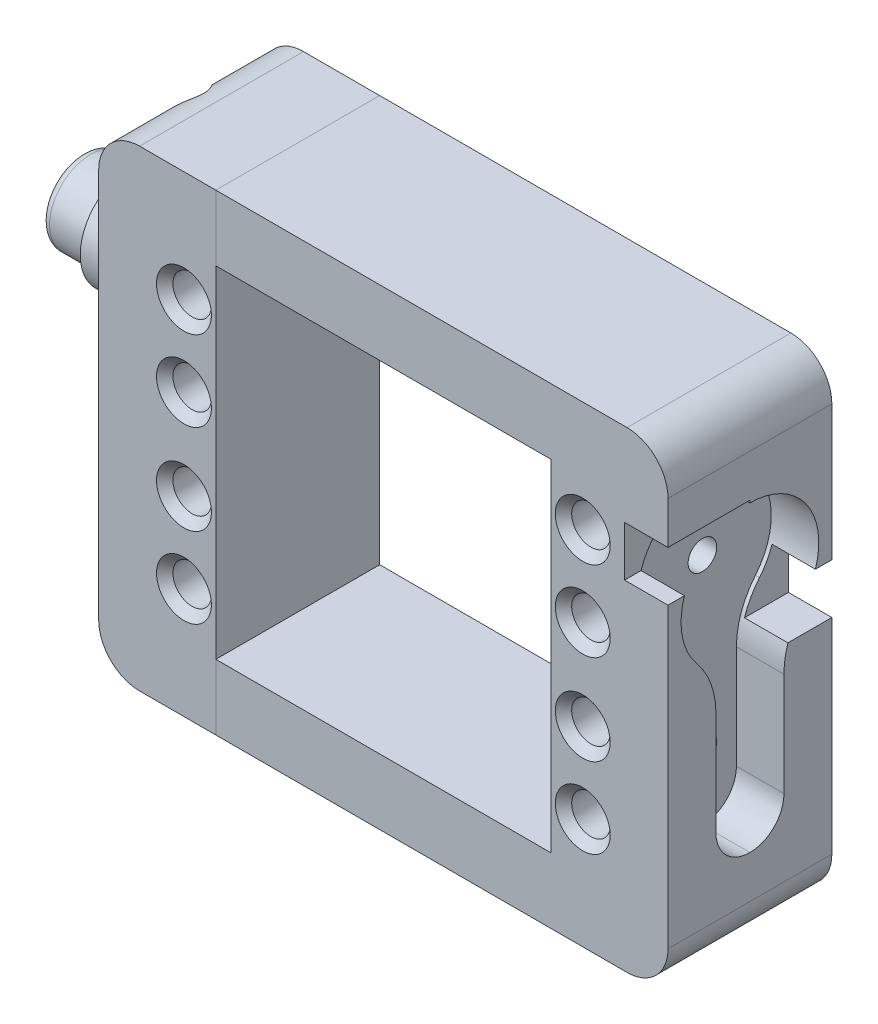
from build123d import *

# Parameters (mm, degrees)
SKETCH1_W              = 20
SKETCH1_H              = 20
BOSS_EXTRUDE1_DEPTH    = 20
SKETCH2_W              = 20
SKETCH2_H              = 70
BOSS_EXTRUDE2_DEPTH    = 10.3
CUT_EXTRUDE1_DEPTH     = 5.8
FILLET1_R              = 4.15
FILLET2_R              = 10
SKETCH5_R              = 1.75
CUT_EXTRUDE2_DEPTH     = 48.361271098
CUT_EXTRUDE3_REACH     = 45.878
SKETCH6_R              = 1.75
SKETCH13_W             = 20
SKETCH13_H             = 20
CUT_EXTRUDE9_DEPTH     = 20
CUT_EXTRUDE18_DEPTH    = 5.3
SKETCH32_W             = 20
SKETCH32_H             = 3.725
BOSS_EXTRUDE3_DEPTH    = 10.3
SKETCH31_W             = 20
SKETCH31_H             = 16.125
CUT_EXTRUDE19_DEPTH    = 42.300310229
SKETCH34_W             = 20
SKETCH34_H             = 57.6
SKETCH34_R             = 1.75
BOSS_EXTRUDE5_DEPTH    = 4
SKETCH35_W             = 20
SKETCH35_H             = 8
BOSS_EXTRUDE6_DEPTH    = 40.9
SKETCH37_W             = 20
SKETCH37_H             = 57.6
BOSS_EXTRUDE7_DEPTH    = 14.3
SKETCH38_R             = 2.35
CUT_EXTRUDE20_DEPTH    = 8
CHAMFER1_SIZE          = 1
SKETCH41_R             = 3.5
CUT_EXTRUDE23_DEPTH    = 4
SKETCH42_R             = 1.75
CUT_EXTRUDE24_DEPTH    = 22.3
SKETCH43_R             = 3.5
CUT_EXTRUDE25_DEPTH    = 11
FILLET3_R              = 5
SPLIT1_SURFACE_1_BACK  = 93.455
SPLIT1_SURFACE_1_DEPTH = 186.91
SPLIT1_SURFACE_2_BACK  = 93.455
SPLIT1_SURFACE_2_DEPTH = 186.91
SKETCH45_R             = 2.35
CUT_EXTRUDE26_DEPTH    = 8
CHAMFER2_SIZE          = 1
SKETCH46_R             = 5
BOSS_EXTRUDE8_DEPTH    = 12
FILLET5_R              = 1
SKETCH50_R             = 6.25
BOSS_EXTRUDE9_DEPTH    = 6
FILLET6_R              = 3


# Some blends are built 0.0001 mm under size
with BuildPart() as part:
    # Sketch1 → Boss-Extrude1 (new body)
    with BuildSketch(Plane(origin=(0, 0, 0), x_dir=(0, 0, -1), z_dir=(1, 0, 0))):
        Rectangle(SKETCH1_W, SKETCH1_H)
    extrude(amount=BOSS_EXTRUDE1_DEPTH)

    # Sketch2 → Boss-Extrude2 (add)
    with BuildSketch(Plane(origin=(20, 0, 0), x_dir=(0, 0, -1), z_dir=(1, 0, 0))):
        Rectangle(SKETCH2_W, SKETCH2_H)
    extrude(amount=BOSS_EXTRUDE2_DEPTH)

    # Sketch4 → Cut-Extrude1 (cut)
    with BuildSketch(Plane(origin=(30.3, 0, 0), x_dir=(0, 0, -1), z_dir=(1, 0, 0))):
        with BuildLine():
            Line((4.15, -28.55), (-4.15, -28.55))
            Line((-4.15, -28.55), (-4.15, -7.311805523))
            ThreePointArc((-4.15, -7.311805523), (0, 8.407437184), (4.15, -7.311805523))
            Line((4.15, -7.311805523), (4.15, -28.55))
        make_face()
    extrude(amount=-CUT_EXTRUDE1_DEPTH, mode=Mode.SUBTRACT)

    # Fillet1
    fillet1_edges = [part.edges().sort_by_distance(p)[0] for p in [
        (27.4, -28.55, 4.15),
        (27.4, -28.55, -4.15),
    ]]
    fillet(fillet1_edges, radius=FILLET1_R - 0.0001)  # a hair under: the kernel refuses the full size

    # Fillet2
    fillet2_edges = [part.edges().sort_by_distance(p)[0] for p in [
        (27.4, -7.311805523, 4.15),
        (27.4, -7.311805523, -4.15),
    ]]
    fillet(fillet2_edges, radius=FILLET2_R)

    # Sketch5 → Cut-Extrude2 (cut, through all)
    with BuildSketch(Plane.ZY):
        Circle(SKETCH5_R)
    extrude(amount=-CUT_EXTRUDE2_DEPTH, mode=Mode.SUBTRACT)

    # Sketch6 → Cut-Extrude3 (cut, up to next)
    with BuildSketch(Plane(origin=(24.5, 0, 0), x_dir=(0, 0, -1), z_dir=(1, 0, 0)), mode=Mode.PRIVATE) as cut_extrude3_sk1:
        with Locations((0, -20.6)):
            Circle(SKETCH6_R)
    cut_extrude3_tool1 = extrude(cut_extrude3_sk1.sketch, amount=-CUT_EXTRUDE3_REACH, mode=Mode.PRIVATE) & part.part
    add(cut_extrude3_tool1.solids().sort_by_distance((24.5, -20.6, 0))[0], mode=Mode.SUBTRACT)

    # Sketch13 → Cut-Extrude9 (cut)
    with BuildSketch(Plane.ZY):
        Rectangle(SKETCH13_W, SKETCH13_H)
    extrude(amount=-CUT_EXTRUDE9_DEPTH, mode=Mode.SUBTRACT)

    # Sketch29 → Cut-Extrude18 (cut)
    with BuildSketch(Plane(origin=(30.3, 0, 0), x_dir=(0, 0, -1), z_dir=(1, 0, 0))):
        Polygon((15.109449768, -8.7), (15.109449768, -2.6), (0, -2.6), (0, -3.8), (0, -7.5), (0, -8.7), align=None)
        Polygon((0, 2.6), (-15.109449768, 2.6), (-15.109449768, 8.7), (0, 8.7), (0, 7.5), (0, 3.8), align=None)
    extrude(amount=-CUT_EXTRUDE18_DEPTH, mode=Mode.SUBTRACT)

    # Sketch32 → Boss-Extrude3 (add)
    with BuildSketch(Plane(origin=(30.3, 0, 0), x_dir=(0, 0, -1), z_dir=(1, 0, 0))):
        with Locations((0, -36.8625)):
            Rectangle(SKETCH32_W, SKETCH32_H)
    extrude(amount=-BOSS_EXTRUDE3_DEPTH)

    # Sketch31 → Cut-Extrude19 (cut, through all)
    with BuildSketch(Plane(origin=(30.3, 0, 0), x_dir=(0, 0, -1), z_dir=(1, 0, 0))):
        with Locations((0, 26.9375)):
            Rectangle(SKETCH31_W, SKETCH31_H)
    extrude(amount=-CUT_EXTRUDE19_DEPTH, mode=Mode.SUBTRACT)

    # Sketch34 → Boss-Extrude5 (add)
    with BuildSketch(Plane.ZY.offset(-20)):
        with Locations((0, -9.925)):
            Rectangle(SKETCH34_W, SKETCH34_H)
        with Locations(Location((0, -20.6, 0), (0, 0, 180))):
            Circle(SKETCH34_R, mode=Mode.SUBTRACT)
        Circle(SKETCH34_R, mode=Mode.SUBTRACT)
    extrude(amount=BOSS_EXTRUDE5_DEPTH)

    # Sketch35 → Boss-Extrude6 (add)
    with BuildSketch(Plane.ZY.offset(-16)):
        with Locations((0, 14.875)):
            Rectangle(SKETCH35_W, SKETCH35_H)
        with Locations((0, -34.725)):
            Rectangle(SKETCH35_W, SKETCH35_H)
    extrude(amount=BOSS_EXTRUDE6_DEPTH)

    # Sketch37 → Boss-Extrude7 (add)
    with BuildSketch(Plane.ZY.offset(24.9)):
        with Locations((0, -9.925)):
            Rectangle(SKETCH37_W, SKETCH37_H)
    extrude(amount=BOSS_EXTRUDE7_DEPTH)

    # Sketch38 → Cut-Extrude20 (cut)
    with BuildSketch(Plane.XY.offset(10)):
        with Locations((-28.79, 5.375)):
            Circle(SKETCH38_R)
        with Locations(Location((-28.79, -4.425, 0), (0, 0, 180))):
            Circle(SKETCH38_R)
        with Locations(Location((-28.79, -25.225, 0), (0, 0, 180))):
            Circle(SKETCH38_R)
        with Locations((-28.79, -15.425)):
            Circle(SKETCH38_R)
        with Locations(Location((19.89, 5.375, 0), (0, 0, 180))):
            Circle(SKETCH38_R)
        with Locations((19.89, -4.425)):
            Circle(SKETCH38_R)
        with Locations(Location((19.89, -15.425, 0), (0, 0, 180))):
            Circle(SKETCH38_R)
        with Locations((19.89, -25.225)):
            Circle(SKETCH38_R)
    extrude(amount=-CUT_EXTRUDE20_DEPTH, mode=Mode.SUBTRACT)

    # Chamfer1
    chamfer1_edges = [part.edges().sort_by_distance(p)[0] for p in [
        (22.24, 5.375, 10),
        (-31.14, -15.425, 10),
        (-26.44, -25.225, 10),
        (-26.44, -4.425, 10),
        (17.54, -4.425, 10),
        (22.24, -15.425, 10),
        (17.54, -25.225, 10),
        (-31.14, 5.375, 10),
    ]]
    chamfer(chamfer1_edges, length=CHAMFER1_SIZE)

    # Sketch41 → Cut-Extrude23 (cut)
    with BuildSketch(Plane.ZY.offset(-16)):
        Circle(SKETCH41_R)
        with Locations((0, -20.6)):
            Circle(SKETCH41_R)
    extrude(amount=-CUT_EXTRUDE23_DEPTH, mode=Mode.SUBTRACT)

    # Sketch42 → Cut-Extrude24 (cut)
    with BuildSketch(Plane.ZY.offset(39.2)):
        with Locations((0, -34.725)):
            Circle(SKETCH42_R)
        with Locations(Location((0, 14.875, 0), (0, 0, 180))):
            Circle(SKETCH42_R)
    extrude(amount=-CUT_EXTRUDE24_DEPTH, mode=Mode.SUBTRACT)

    # Sketch43 → Cut-Extrude25 (cut)
    with BuildSketch(Plane.ZY.offset(39.2)):
        with Locations((0, 14.875)):
            Circle(SKETCH43_R)
        with Locations((0, -34.725)):
            Circle(SKETCH43_R)
    extrude(amount=-CUT_EXTRUDE25_DEPTH, mode=Mode.SUBTRACT)

    # Fillet3
    # the kernel refuses this fillet: 5 mm, written as the material it takes off along each edge
    with BuildSketch(Plane(origin=(30.3, -38.725, -22.5), x_dir=(-1, 0, 0), z_dir=(0, 0, 1)), Plane(origin=(-39.2, 18.875, -22.5), x_dir=(1, 0, 0), z_dir=(0, 0, 1))) as fillet3_piece_1:
        with BuildLine():
            CenterArc((FILLET3_R, -FILLET3_R), FILLET3_R, 90, 90)
            Line((0, -FILLET3_R), (0, 0))
            Line((0, 0), (FILLET3_R, 0))
        make_face()
    extrude(amount=45, mode=Mode.SUBTRACT)
    with BuildSketch(Plane(origin=(30.3, 18.875, -22.5), x_dir=(-1, 0, 0), z_dir=(0, 0, 1)), Plane(origin=(-39.2, -38.725, 22.5), x_dir=(0, 1, 0), z_dir=(0, 0, -1))) as fillet3_piece_2:
        with BuildLine():
            CenterArc((FILLET3_R, FILLET3_R), FILLET3_R, 180, 90)
            Line((0, FILLET3_R), (0, 0))
            Line((0, 0), (FILLET3_R, 0))
        make_face()
    extrude(amount=45, mode=Mode.SUBTRACT)


with BuildPart() as body_2:
    # Split1: the piece behind the surface
    add(part.part)
    # Split1 surface: a surface, the sketch's curves swept straight by 186.91 mm
    with BuildLine(Plane.XY.offset(10).offset(-SPLIT1_SURFACE_1_BACK), mode=Mode.PRIVATE) as split1_surface_1_path:
        Line((-24.9, 18.875), (-24.9, -38.725))
    split1_surface_1 = Shell.extrude(split1_surface_1_path.wire(), (0 * SPLIT1_SURFACE_1_DEPTH, 0 * SPLIT1_SURFACE_1_DEPTH, 1 * SPLIT1_SURFACE_1_DEPTH))
    split(bisect_by=split1_surface_1, keep=Keep.BOTTOM)

    # Sketch46 → Boss-Extrude8 (add)
    with BuildSketch(Plane.ZY.offset(39.2)):
        Circle(SKETCH46_R)
    extrude(amount=BOSS_EXTRUDE8_DEPTH)

    # Fillet5
    fillet5_edges = [body_2.edges().sort_by_distance(p)[0] for p in [
        (-51.2, 0, -5),
    ]]
    fillet(fillet5_edges, radius=FILLET5_R)

    # Sketch50 → Boss-Extrude9 (add)
    with BuildSketch(Plane.ZY.offset(39.2)):
        Circle(SKETCH50_R)
    extrude(amount=BOSS_EXTRUDE9_DEPTH)

    # Fillet6
    fillet6_edges = [body_2.edges().sort_by_distance(p)[0] for p in [
        (-39.2, 0, -6.25),
    ]]
    fillet(fillet6_edges, radius=FILLET6_R)


with BuildPart() as part_1:
    add(part.part)

    # Split1: split by a surface, the side it looks to stays
    # Split1 surface: a surface, the sketch's curves swept straight by 186.91 mm
    with BuildLine(Plane.XY.offset(10).offset(-SPLIT1_SURFACE_2_BACK), mode=Mode.PRIVATE) as split1_surface_2_path:
        Line((-24.9, 18.875), (-24.9, -38.725))
    split1_surface_2 = Shell.extrude(split1_surface_2_path.wire(), (0 * SPLIT1_SURFACE_2_DEPTH, 0 * SPLIT1_SURFACE_2_DEPTH, 1 * SPLIT1_SURFACE_2_DEPTH))
    split(bisect_by=split1_surface_2, keep=Keep.TOP)

    # Sketch45 → Cut-Extrude26 (cut)
    with BuildSketch(Plane.ZY.offset(24.9)):
        with Locations((0, 14.875)):
            Circle(SKETCH45_R)
        with Locations((0, -34.725)):
            Circle(SKETCH45_R)
    extrude(amount=-CUT_EXTRUDE26_DEPTH, mode=Mode.SUBTRACT)

    # Chamfer2
    chamfer2_edges = [part_1.edges().sort_by_distance(p)[0] for p in [
        (-24.9, 14.875, -2.35),
        (-24.9, -34.725, -2.35),
    ]]
    chamfer(chamfer2_edges, length=CHAMFER2_SIZE)


solid = Compound([body_2.part, part_1.part])
